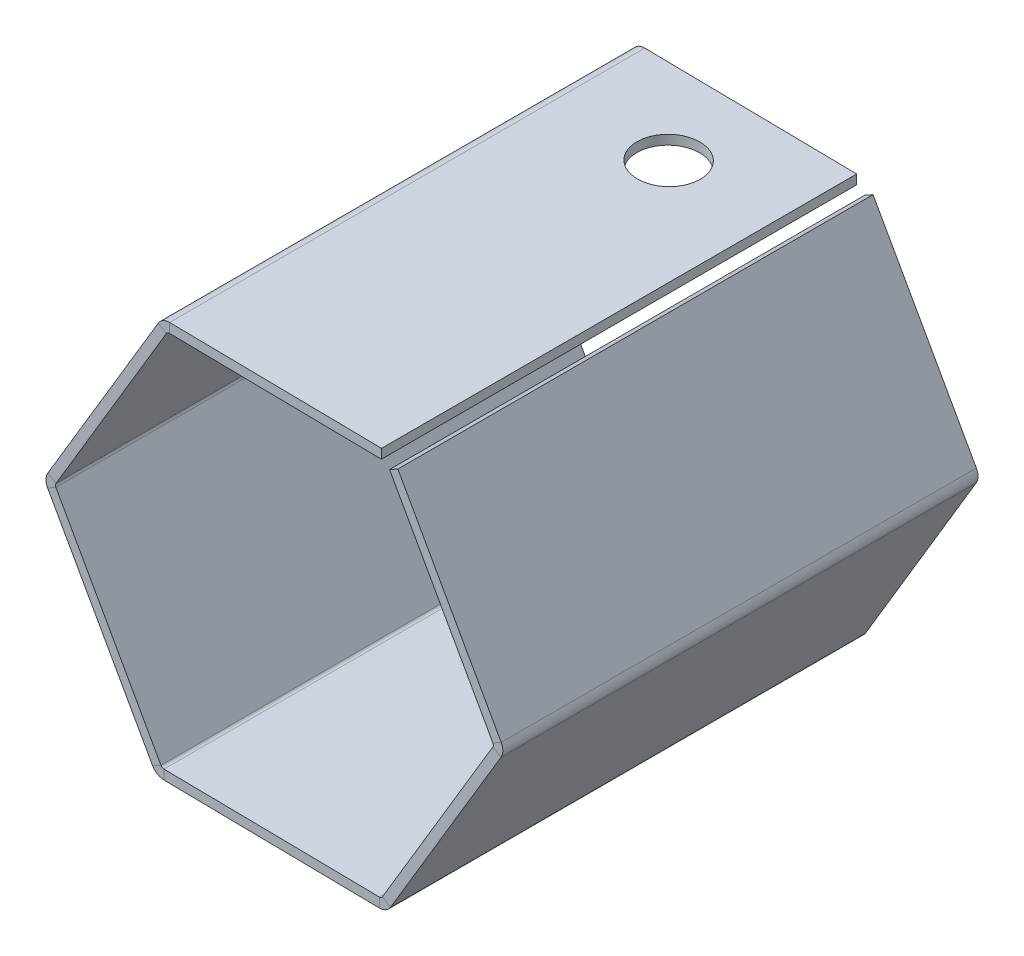
from build123d import *

# Parameters (mm, degrees)
LOFTED_BENDS1_DEPTH = 100
SKETCH8_R           = 6.657402664
CUT_EXTRUDE1_DEPTH  = 130


# Read off the part's stored shape, not the designer's step: Lofted Bends1
with BuildPart() as part:
    # Lofted Bends1 outline → Lofted Bends1 (new body)
    with BuildSketch(Plane.XY):
        with BuildLine():
            Line((47.722213143, 0.679631709), (25.978056207, 39.629205506))
            Line((25.978056207, 39.629205506), (24.23175354, 38.654307053))
            Line((24.23175354, 38.654307053), (45.975910476, -0.295266745))
            ThreePointArc((45.975910476, -0.295266745), (46.069270486, -0.664952643), (45.965279678, -1.031790027))
            Line((45.965279678, -1.031790027), (22.732246736, -39.963939806))
            ThreePointArc((22.732246736, -39.963939806), (22.458769362, -40.229634896), (22.089083464, -40.322994907))
            Line((22.089083464, -40.322994907), (-23.24366374, -39.668673062))
            ThreePointArc((-23.24366374, -39.668673062), (-23.610501124, -39.564682253), (-23.876196214, -39.291204879))
            Line((-23.876196214, -39.291204879), (-45.975910476, 0.295266745))
            ThreePointArc((-45.975910476, 0.295266745), (-46.069270486, 0.664952643), (-45.965279678, 1.031790027))
            Line((-45.965279678, 1.031790027), (-22.732246736, 39.963939806))
            ThreePointArc((-22.732246736, 39.963939806), (-22.458769362, 40.229634896), (-22.089083464, 40.322994907))
            Line((-22.089083464, 40.322994907), (22.514315379, 39.679200299))
            Line((22.514315379, 39.679200299), (22.543179886, 41.678991998))
            Line((22.543179886, 41.678991998), (-22.060218957, 42.322786606))
            ThreePointArc((-22.060218957, 42.322786606), (-23.433667815, 41.975937564), (-24.449684896, 40.988833052))
            Line((-24.449684896, 40.988833052), (-47.682717838, 2.056683273))
            ThreePointArc((-47.682717838, 2.056683273), (-48.069062185, 0.69381715), (-47.722213143, -0.679631709))
            Line((-47.722213143, -0.679631709), (-25.622498881, -40.266103333))
            ThreePointArc((-25.622498881, -40.266103333), (-24.63539437, -41.282120414), (-23.272528247, -41.668464761))
            Line((-23.272528247, -41.668464761), (22.060218957, -42.322786606))
            ThreePointArc((22.060218957, -42.322786606), (23.433667815, -41.975937564), (24.449684896, -40.988833052))
            Line((24.449684896, -40.988833052), (47.682717838, -2.056683273))
            ThreePointArc((47.682717838, -2.056683273), (48.069062185, -0.69381715), (47.722213143, 0.679631709))
        make_face()
    extrude(amount=LOFTED_BENDS1_DEPTH)

    # Sketch8 → Cut-Extrude1 (cut)
    with BuildSketch(Plane(origin=(0.606154645, 41.995625683, 0), x_dir=(0.9998958496065499, -0.014432253448298253, 0), z_dir=(0.014432253448298252, 0.9998958496065498, 0))):
        with Locations((0, -17.644210067)):
            Circle(SKETCH8_R)
    extrude(amount=-CUT_EXTRUDE1_DEPTH, mode=Mode.SUBTRACT)


solid = part.part
